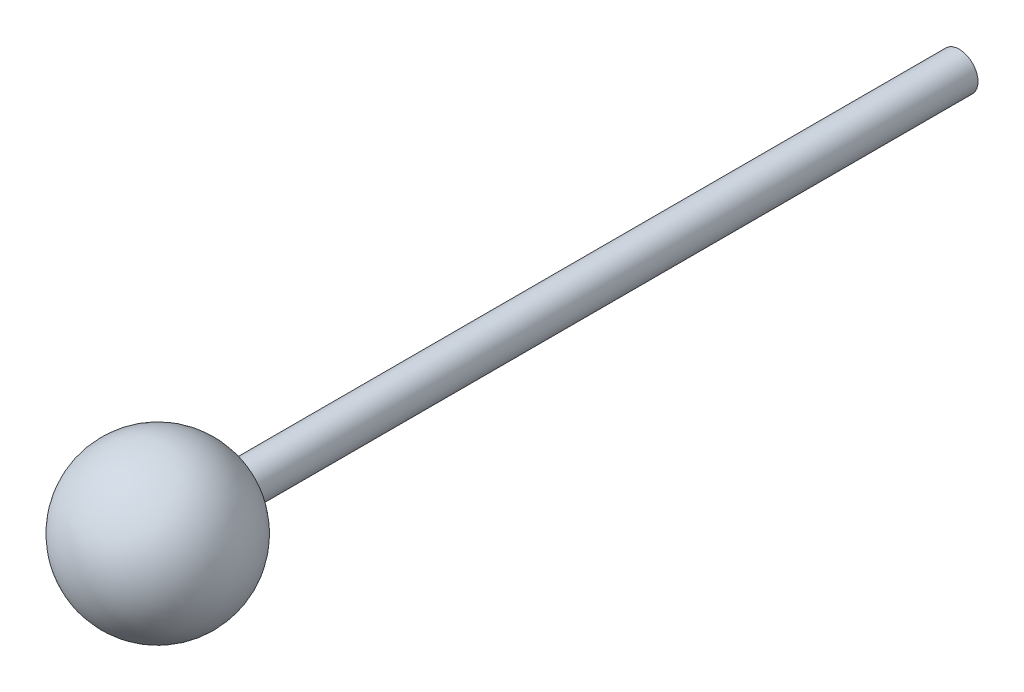
from build123d import *

# Parameters (mm, degrees)
SKETCH1_R           = 0.59375
BOSS_EXTRUDE1_DEPTH = 25.34


with BuildPart() as part:
    # Sketch1 → Boss-Extrude1 (new body)
    with BuildSketch(Plane.XY):
        Circle(SKETCH1_R)
    extrude(amount=BOSS_EXTRUDE1_DEPTH)

    # Sketch2 → Revolve1 (revolve)
    with BuildSketch(Plane.XY.offset(25.34)):
        with BuildLine():
            ThreePointArc((0, 2.5), (-2.5, 0), (0, -2.5))
            Line((0, -2.5), (0, -0.59375))
            ThreePointArc((0, -0.59375), (-0.59375, 0), (0, 0.59375))
            Line((0, 0.59375), (0, 2.5))
        make_face()
    revolve(axis=Axis((0, -2.5, 25.34), (0, 1, 0)))


solid = part.part
